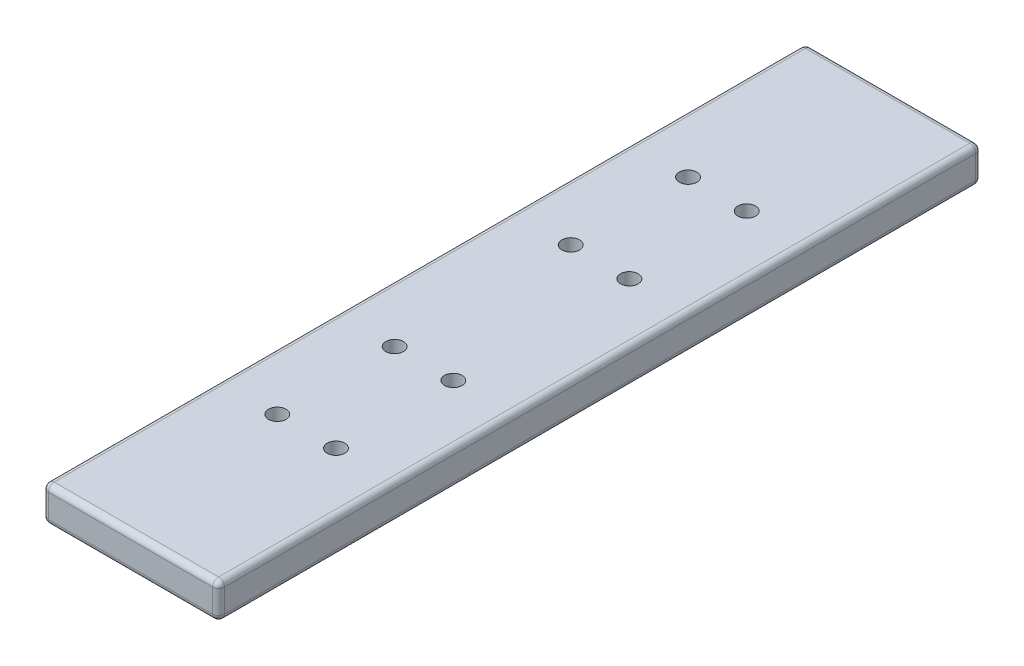
from build123d import *

# Parameters (mm, degrees)
SKETCH2_W           = 30
SKETCH2_H           = 6
BOSS_EXTRUDE1_DEPTH = 130
SKETCH3_R           = 1.5
CUT_EXTRUDE3_DEPTH  = 132
FILLET1_R           = 1


with BuildPart() as part:
    # Sketch2 → Boss-Extrude1 (new body)
    with BuildSketch(Plane.XY):
        Rectangle(SKETCH2_W, SKETCH2_H)
    extrude(amount=BOSS_EXTRUDE1_DEPTH)

    # Sketch3 → Cut-Extrude3 (cut, through all)
    with BuildSketch(Plane(origin=(0, 3, 0), x_dir=(1, 0, 0), z_dir=(0, 1, 0))):
        with Locations((-5, -100)):
            Circle(SKETCH3_R)
        with Locations((5, -100)):
            Circle(SKETCH3_R)
        with Locations((5, -80)):
            Circle(SKETCH3_R)
        with Locations((-5, -80)):
            Circle(SKETCH3_R)
        with Locations((-5, -50)):
            Circle(SKETCH3_R)
        with Locations((5, -50)):
            Circle(SKETCH3_R)
        with Locations((5, -30)):
            Circle(SKETCH3_R)
        with Locations((-5, -30)):
            Circle(SKETCH3_R)
    extrude(amount=-CUT_EXTRUDE3_DEPTH, mode=Mode.SUBTRACT)

    # Fillet1
    fillet1_edges = [part.edges().sort_by_distance(p)[0] for p in [
        (15, 0, 0),
        (-15, 0, 0),
        (-15, 0, 130),
        (15, 0, 130),
        (-15, -3, 65),
        (0, -3, 130),
        (15, -3, 65),
        (0, -3, 0),
        (15, 3, 65),
        (0, 3, 130),
        (-15, 3, 65),
        (0, 3, 0),
    ]]
    fillet(fillet1_edges, radius=FILLET1_R)


solid = part.part
